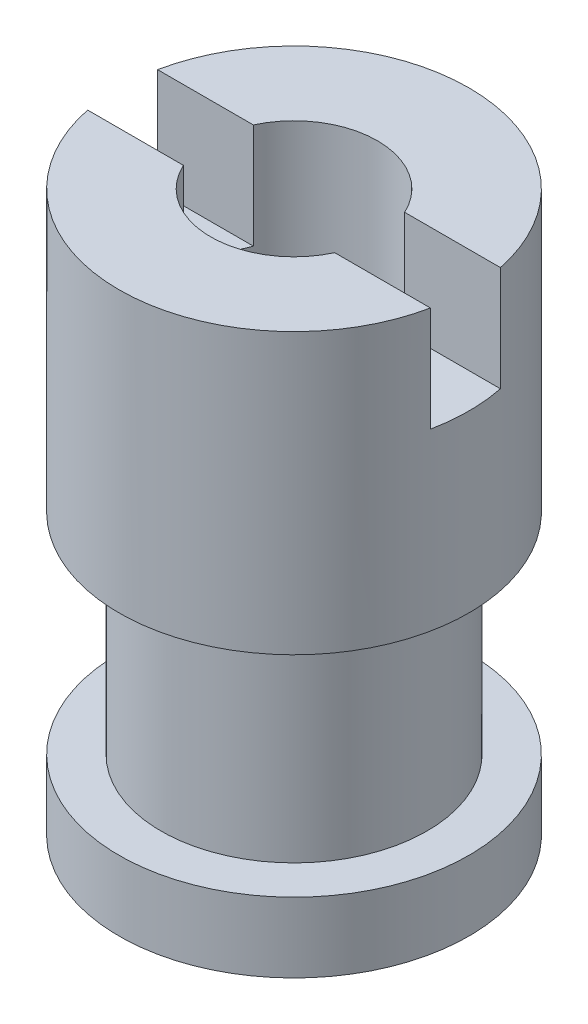
from build123d import *

# Parameters (mm, degrees)
CUT_EXTRUDE1_DEPTH = 0.75
SKETCH3_R          = 0.59563
CUT_EXTRUDE2_DEPTH = 5.373213921


with BuildPart() as part:
    # Sketch1 → Revolve1 (revolve)
    with BuildSketch(Plane.XY):
        Polygon((0, 0), (1.25, 0), (1.25, 0.5), (0.95, 0.5), (0.95, 2), (1.25, 2), (1.25, 4), (0, 4), align=None)
    revolve(axis=Axis((0, 0, 0), (0, 1, 0)))

    # Sketch2 → Cut-Extrude1 (cut)
    with BuildSketch(Plane(origin=(0, 4, 0), x_dir=(1, 0, 0), z_dir=(0, 1, 0))):
        Polygon((0, -0.25), (-1.5, -0.25), (-1.5, 0.25), (1.5, 0.25), (1.5, -0.25), align=None)
    extrude(amount=-CUT_EXTRUDE1_DEPTH, mode=Mode.SUBTRACT)

    # Sketch3 → Cut-Extrude2 (cut, through all)
    with BuildSketch(Plane.XZ):
        Circle(SKETCH3_R)
    extrude(amount=-CUT_EXTRUDE2_DEPTH, mode=Mode.SUBTRACT)


solid = part.part
